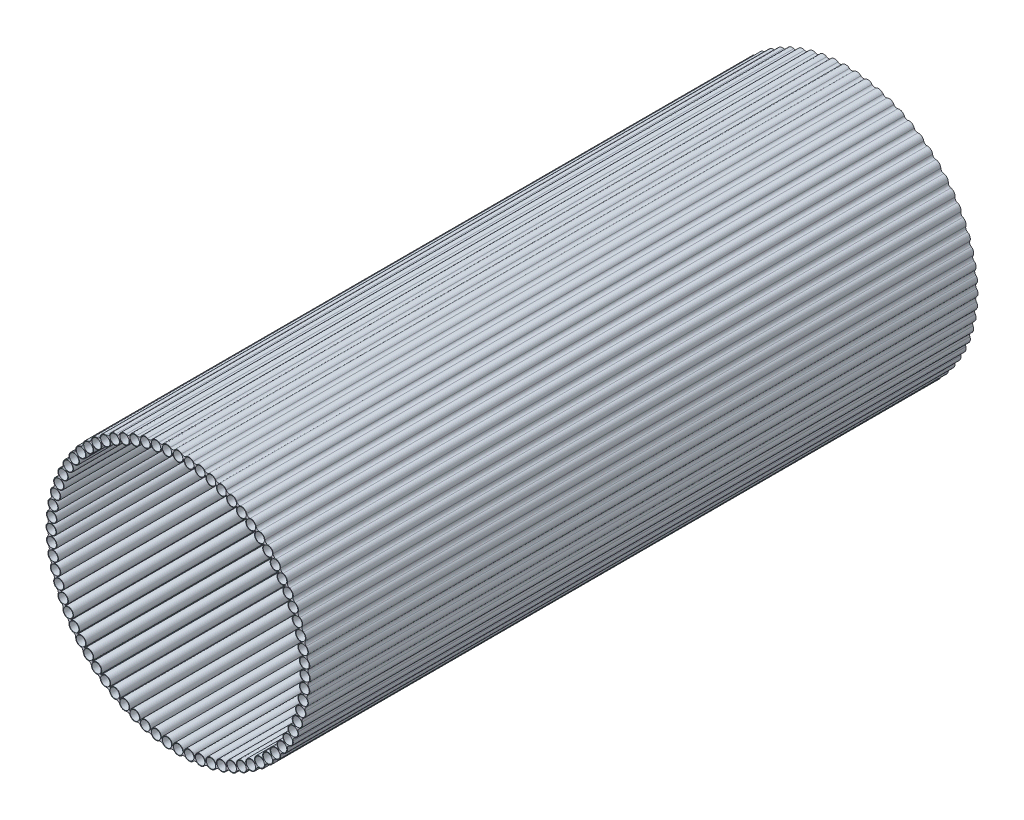
from build123d import *

# Parameters (mm, degrees)
SKETCH1_R           = 2.3876
SKETCH1_R_2         = 2.1336
BOSS_EXTRUDE1_DEPTH = 304.8
CIRPATTERN1_COUNT   = 72


with BuildPart() as part:
    # Sketch1 → Boss-Extrude1 (new body)
    # profile 1 of 2: a face of its own
    with BuildSketch(Plane(origin=(0, 0, 0), x_dir=(0, 1, 0), z_dir=(0, 0, 1))):
        with Locations((0, 57.9374)):
            Circle(SKETCH1_R)
        with Locations(Location((0, 57.9374, 0), (0, 0, 270))):
            Circle(SKETCH1_R_2, mode=Mode.SUBTRACT)
    # profile 2 of 2: a face of its own
    with BuildSketch(Plane(origin=(0, 0, 0), x_dir=(0, 1, 0), z_dir=(0, 0, 1))):
        with BuildLine():
            ThreePointArc((1.629756703, 59.682257258), (2.189959002, 58.888564196), (2.3876, 57.9374))
            ThreePointArc((2.3876, 57.9374), (2.529338904, 57.931385252), (2.671062669, 57.925023753))
            ThreePointArc((2.671062669, 57.925023753), (2.950851005, 58.855342934), (3.578096474, 59.597190906))
            ThreePointArc((3.578096474, 59.597190906), (2.588215649, 59.279884409), (1.629756703, 59.682257258))
        make_face()
    boss_extrude1 = extrude(amount=BOSS_EXTRUDE1_DEPTH)

    # CirPattern1: Boss-Extrude1 ×72 about axis
    cirpattern1_axis = Axis((0, 0, 0), (0, 0, 1))
    for i in range(1, CIRPATTERN1_COUNT):
        add(boss_extrude1.rotate(cirpattern1_axis, i * 360 / CIRPATTERN1_COUNT))


solid = part.part
